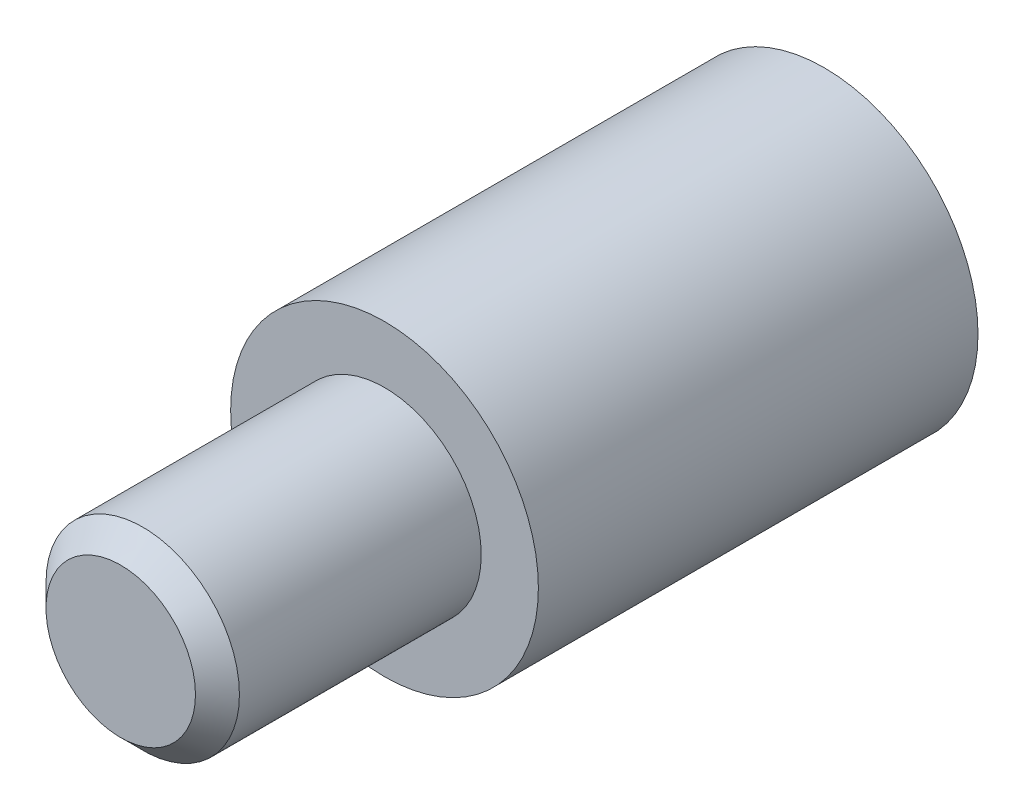
from build123d import *

# Parameters (mm, degrees)
SKETCH1_R           = 3.5
BOSS_EXTRUDE1_DEPTH = 7
SKETCH2_R           = 3.5
SKETCH2_R_2         = 2
BOSS_EXTRUDE2_DEPTH = 3
SKETCH3_R           = 2.2
BOSS_EXTRUDE3_DEPTH = 6
CHAMFER1_SIZE       = 0.5


with BuildPart() as part:
    # Sketch1 → Boss-Extrude1 (new body)
    with BuildSketch(Plane(origin=(0, 0, 106.93542322), x_dir=(-1, 0, 0), z_dir=(0, 0, -1))):
        with Locations((-59.79735108, 58.015798494)):
            Circle(SKETCH1_R)
    extrude(amount=BOSS_EXTRUDE1_DEPTH)

    # Sketch2 → Boss-Extrude2 (add)
    with BuildSketch(Plane(origin=(0, 0, 99.93542322), x_dir=(-1, 0, 0), z_dir=(0, 0, -1))):
        with Locations((-59.79735108, 58.015798494)):
            Circle(SKETCH2_R)
        with Locations((-59.79735108, 58.015798494)):
            Circle(SKETCH2_R_2, mode=Mode.SUBTRACT)
    extrude(amount=BOSS_EXTRUDE2_DEPTH)

    # Sketch3 → Boss-Extrude3 (add)
    with BuildSketch(Plane.XY.offset(106.93542322)):
        with Locations((59.79735108, 58.015798494)):
            Circle(SKETCH3_R)
    extrude(amount=BOSS_EXTRUDE3_DEPTH)

    # Chamfer1
    chamfer1_edges = [part.edges().sort_by_distance(p)[0] for p in [
        (57.59735108, 58.015798494, 112.93542322),
    ]]
    chamfer(chamfer1_edges, length=CHAMFER1_SIZE)


solid = part.part
